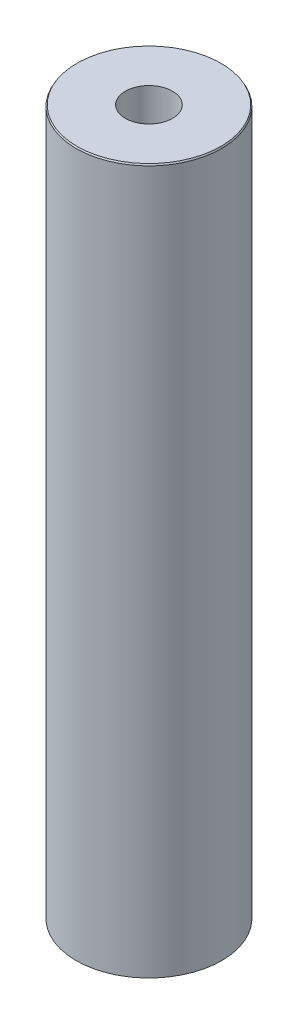
from build123d import *
from OCP.BRepFilletAPI import BRepFilletAPI_MakeChamfer

# Parameters (mm, degrees)
SKETCH1_R           = 55
BOSS_EXTRUDE1_DEPTH = 532.855554277
SKETCH2_R           = 17.809664276
CUT_EXTRUDE1_DEPTH  = 539.502592124
CHAMFER1_SIZE       = 1.092726926
CHAMFER1_SIZE2      = 0.630886185


with BuildPart() as part:
    # Sketch1 → Boss-Extrude1 (new body)
    with BuildSketch(Plane(origin=(0, 0, 0), x_dir=(1, 0, 0), z_dir=(0, 1, 0))):
        Circle(SKETCH1_R)
    extrude(amount=BOSS_EXTRUDE1_DEPTH)

    # Sketch2 → Cut-Extrude1 (cut, through all)
    with BuildSketch(Plane(origin=(0, 0, 0), x_dir=(1, 0, 0), z_dir=(0, 1, 0))):
        Circle(SKETCH2_R)
    extrude(amount=CUT_EXTRUDE1_DEPTH, mode=Mode.SUBTRACT)

    # Chamfer1: one chamfer whose edges measure the first distance from different faces: ONE call of the kernel's chamfer builder (chamfer() names one face for all edges)
    chamfer1_edges_1 = [part.edges().sort_by_distance(p)[0] for p in [
        (-55, 532.855554277, 0),
    ]]
    chamfer1_side_1 = [part.faces().sort_by_distance(p)[0] for p in [
        (-55, 266.427777138, 0),
    ]]
    chamfer1_edges_2 = [part.edges().sort_by_distance(p)[0] for p in [
        (-55, 0, 0),
    ]]
    chamfer1_side_2 = [part.faces().sort_by_distance(p)[0] for p in [
        (-53.444365081, 0, 0),
    ]]
    chamfer1 = BRepFilletAPI_MakeChamfer(part.part.solid().wrapped)
    for e in chamfer1_edges_1:
        chamfer1.Add(CHAMFER1_SIZE, CHAMFER1_SIZE2, e.wrapped, chamfer1_side_1[0].wrapped)  # the first distance lies on this face
    for e in chamfer1_edges_2:
        chamfer1.Add(CHAMFER1_SIZE, CHAMFER1_SIZE2, e.wrapped, chamfer1_side_2[0].wrapped)  # the first distance lies on this face
    add(Compound.cast(chamfer1.Shape()), mode=Mode.REPLACE)


solid = part.part
